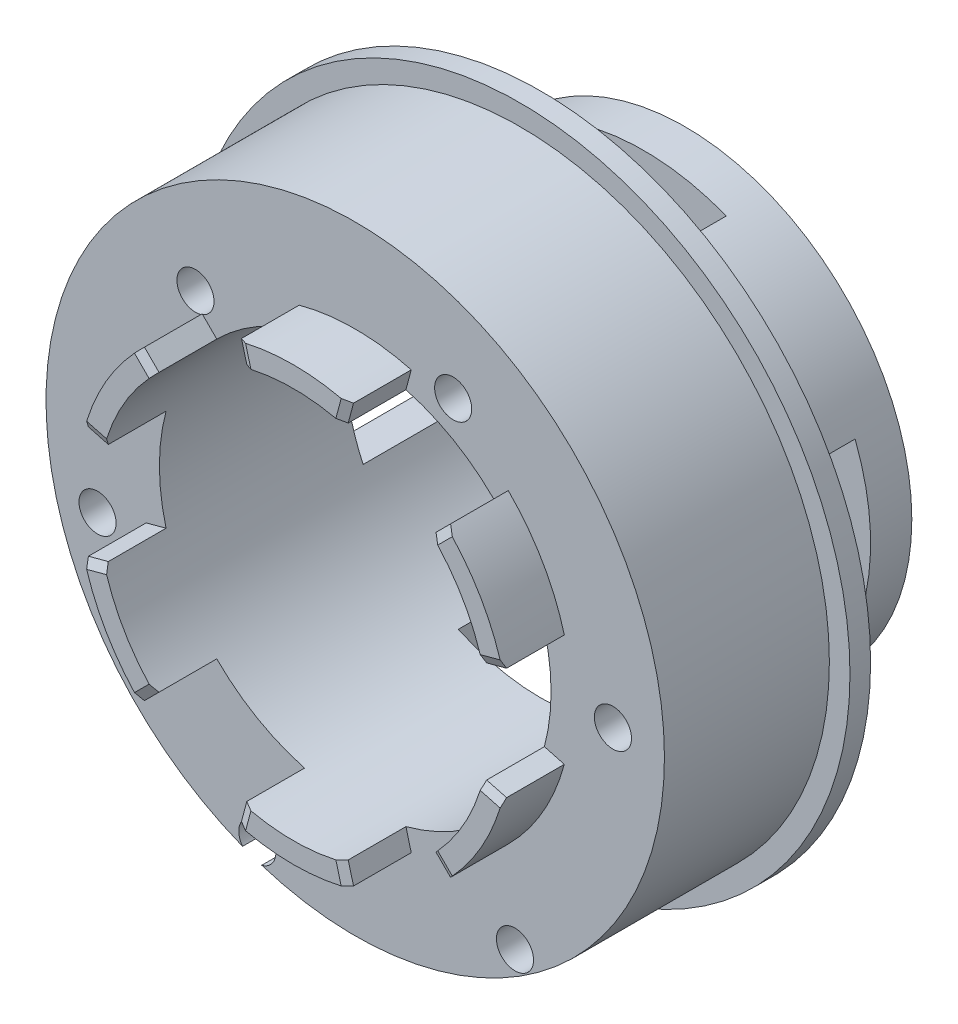
from build123d import *
from OCP.BRepFilletAPI import BRepFilletAPI_MakeChamfer

# Parameters (mm, degrees)
SKETCH_1_R               = 11
EXTRUDE_1_DEPTH          = 2
SKETCH_2_R               = 11
SKETCH_2_R_2             = 9.5
EXTRUDE_2_DEPTH          = 5
SKETCH_4_R               = 16
SKETCH_4_R_2             = 9.5
EXTRUDE_3_DEPTH          = 1
SKETCH_5_R               = 15
SKETCH_5_R_2             = 9.5
EXTRUDE_4_DEPTH          = 8
SKETCH_6_R               = 0.9
CUT_EXTRUDE_1_DEPTH      = 8
SKETCH_7_R               = 3
SKETCH_7_R_2             = 1
CUT_EXTRUDE_2_DEPTH      = 28.712812921
CUT_EXTRUDE_3_DEPTH      = 28.712812921
CUT_EXTRUDE_3_DEPTH_BACK = 28.712812921
SKETCH_8_W               = 8
SKETCH_8_H               = 5
CUT_EXTRUDE_4_DEPTH      = 28.712812921
CUT_EXTRUDE_4_DEPTH_BACK = 28.712812921
SKETCH_9_W               = 5
SKETCH_9_H               = 8
EXTRUDE_5_DEPTH          = 3
CHAMFER_1_SIZE           = 0.2
CHAMFER_1_SIZE2          = 0.410060768


with BuildPart() as part:
    # 스케치1 → 보스-돌출1 (new body)
    with BuildSketch(Plane.XY):
        Circle(SKETCH_1_R)
    extrude(amount=EXTRUDE_1_DEPTH)

    # 스케치2 → 보스-돌출2 (add)
    with BuildSketch(Plane.XY.offset(2)):
        Circle(SKETCH_2_R)
        Circle(SKETCH_2_R_2, mode=Mode.SUBTRACT)
    extrude(amount=EXTRUDE_2_DEPTH)

    # 스케치4 → 보스-돌출3 (add)
    with BuildSketch(Plane.XY.offset(7)):
        Circle(SKETCH_4_R)
        Circle(SKETCH_4_R_2, mode=Mode.SUBTRACT)
    extrude(amount=EXTRUDE_3_DEPTH)

    # 스케치5 → 보스-돌출4 (add)
    with BuildSketch(Plane.XY.offset(8)):
        Circle(SKETCH_5_R)
        Circle(SKETCH_5_R_2, mode=Mode.SUBTRACT)
    extrude(amount=EXTRUDE_4_DEPTH)

    # 스케치6 → 컷-돌출1 (cut)
    with BuildSketch(Plane.XY.offset(16)):
        with Locations((12.5, 0)):
            Circle(SKETCH_6_R)
        with Locations((7.75, -11.691342951)):
            Circle(SKETCH_6_R)
        with Locations((-4.75, -13.423393759)):
            Circle(SKETCH_6_R)
        with Locations((-12.5, -3.464101615)):
            Circle(SKETCH_6_R)
        with Locations((-7.75, 8.227241336)):
            Circle(SKETCH_6_R)
        with Locations((4.75, 9.959292144)):
            Circle(SKETCH_6_R)
    extrude(amount=-CUT_EXTRUDE_1_DEPTH, mode=Mode.SUBTRACT)

    # 스케치7 → 컷-돌출2 (cut, through all)
    with BuildSketch(Plane(origin=(0, 0, 0), x_dir=(-1, 0, 0), z_dir=(0, 0, -1))):
        Circle(SKETCH_7_R)
        with Locations((-8, 0)):
            Circle(SKETCH_7_R_2)
        with Locations((8, 0)):
            Circle(SKETCH_7_R_2)
        with Locations((0, 8)):
            Circle(SKETCH_7_R_2)
        with Locations((0, -8)):
            Circle(SKETCH_7_R_2)
    extrude(amount=-CUT_EXTRUDE_2_DEPTH, mode=Mode.SUBTRACT)

    # 스케치8 → 컷-돌출3 (cut, two sides: drawn at the far end of the back side and taken through both)
    with BuildSketch(Plane(origin=(0, 0, 0), x_dir=(1, 0, 0), z_dir=(0, 1, 0)).offset(-CUT_EXTRUDE_3_DEPTH_BACK)):
        with Locations((0, -4.5)):
            Rectangle(SKETCH_8_W, SKETCH_8_H)
    extrude(amount=CUT_EXTRUDE_3_DEPTH + CUT_EXTRUDE_3_DEPTH_BACK, mode=Mode.SUBTRACT)

    # 스케치9 → 컷-돌출4 (cut, two sides: drawn at the far end of the back side and taken through both)
    with BuildSketch(Plane(origin=(0, 0, 0), x_dir=(0, 0, -1), z_dir=(1, 0, 0)).offset(-CUT_EXTRUDE_4_DEPTH_BACK)):
        with Locations((-4.5, 0)):
            Rectangle(SKETCH_9_W, SKETCH_9_H)
    extrude(amount=CUT_EXTRUDE_4_DEPTH + CUT_EXTRUDE_4_DEPTH_BACK, mode=Mode.SUBTRACT)

    # 스케치10 → 보스-돌출5 (add)
    with BuildSketch(Plane.XY.offset(16)):
        with BuildLine():
            Line((2.458780928, 9.17629535), (2.717599974, 10.142221176))
            ThreePointArc((2.717599974, 10.142221176), (0, 10.5), (-2.717599974, 10.142221176))
            Line((-2.717599974, 10.142221176), (-2.458780928, 9.17629535))
            ThreePointArc((-2.458780928, 9.17629535), (0, 9.5), (2.458780928, 9.17629535))
        make_face()
        with BuildLine():
            Line((6.717514421, 6.717514421), (7.424621202, 7.424621202))
            ThreePointArc((7.424621202, 7.424621202), (9.09326674, 5.25), (10.142221176, 2.717599974))
            Line((10.142221176, 2.717599974), (9.17629535, 2.458780928))
            ThreePointArc((9.17629535, 2.458780928), (8.227241336, 4.75), (6.717514421, 6.717514421))
        make_face()
        with BuildLine():
            Line((9.17629535, -2.458780928), (10.142221176, -2.717599974))
            ThreePointArc((10.142221176, -2.717599974), (9.09326674, -5.25), (7.424621202, -7.424621202))
            Line((7.424621202, -7.424621202), (6.717514421, -6.717514421))
            ThreePointArc((6.717514421, -6.717514421), (8.227241336, -4.75), (9.17629535, -2.458780928))
        make_face()
        with BuildLine():
            Line((2.458780928, -9.17629535), (2.717599974, -10.142221176))
            ThreePointArc((2.717599974, -10.142221176), (0, -10.5), (-2.717599974, -10.142221176))
            Line((-2.717599974, -10.142221176), (-2.458780928, -9.17629535))
            ThreePointArc((-2.458780928, -9.17629535), (0, -9.5), (2.458780928, -9.17629535))
        make_face()
        with BuildLine():
            Line((-6.717514421, -6.717514421), (-7.424621202, -7.424621202))
            ThreePointArc((-7.424621202, -7.424621202), (-9.09326674, -5.25), (-10.142221176, -2.717599974))
            Line((-10.142221176, -2.717599974), (-9.17629535, -2.458780928))
            ThreePointArc((-9.17629535, -2.458780928), (-8.227241336, -4.75), (-6.717514421, -6.717514421))
        make_face()
        with BuildLine():
            Line((-9.17629535, 2.458780928), (-10.142221176, 2.717599974))
            ThreePointArc((-10.142221176, 2.717599974), (-9.09326674, 5.25), (-7.424621202, 7.424621202))
            Line((-7.424621202, 7.424621202), (-6.717514421, 6.717514421))
            ThreePointArc((-6.717514421, 6.717514421), (-8.227241336, 4.75), (-9.17629535, 2.458780928))
        make_face()
    extrude(amount=EXTRUDE_5_DEPTH)

    # 모따기1: one chamfer whose edges measure the first distance from different faces: ONE call of the kernel's chamfer builder (chamfer() names one face for all edges)
    chamfer_1_edges_1 = [part.edges().sort_by_distance(p)[0] for p in [
        (-9.659258263, -2.588190451, 19),
    ]]
    chamfer_1_side_1 = [part.faces().sort_by_distance(p)[0] for p in [
        (-9.659258263, -2.588190451, 17.5),
    ]]
    chamfer_1_edges_2 = [part.edges().sort_by_distance(p)[0] for p in [
        (-7.071067812, -7.071067812, 19),
    ]]
    chamfer_1_side_2 = [part.faces().sort_by_distance(p)[0] for p in [
        (-7.071067812, -7.071067812, 17.5),
    ]]
    chamfer_1_edges_3 = [part.edges().sort_by_distance(p)[0] for p in [
        (-2.588190451, -9.659258263, 19),
    ]]
    chamfer_1_side_3 = [part.faces().sort_by_distance(p)[0] for p in [
        (-2.588190451, -9.659258263, 17.5),
    ]]
    chamfer_1_edges_4 = [part.edges().sort_by_distance(p)[0] for p in [
        (2.588190451, -9.659258263, 19),
    ]]
    chamfer_1_side_4 = [part.faces().sort_by_distance(p)[0] for p in [
        (2.588190451, -9.659258263, 17.5),
    ]]
    chamfer_1_edges_5 = [part.edges().sort_by_distance(p)[0] for p in [
        (7.071067812, -7.071067812, 19),
    ]]
    chamfer_1_side_5 = [part.faces().sort_by_distance(p)[0] for p in [
        (7.071067812, -7.071067812, 17.5),
    ]]
    chamfer_1_edges_6 = [part.edges().sort_by_distance(p)[0] for p in [
        (9.659258263, -2.588190451, 19),
    ]]
    chamfer_1_side_6 = [part.faces().sort_by_distance(p)[0] for p in [
        (9.659258263, -2.588190451, 17.5),
    ]]
    chamfer_1_edges_7 = [part.edges().sort_by_distance(p)[0] for p in [
        (9.659258263, 2.588190451, 19),
    ]]
    chamfer_1_side_7 = [part.faces().sort_by_distance(p)[0] for p in [
        (9.659258263, 2.588190451, 17.5),
    ]]
    chamfer_1_edges_8 = [part.edges().sort_by_distance(p)[0] for p in [
        (7.071067812, 7.071067812, 19),
    ]]
    chamfer_1_side_8 = [part.faces().sort_by_distance(p)[0] for p in [
        (7.071067812, 7.071067812, 17.5),
    ]]
    chamfer_1_edges_9 = [part.edges().sort_by_distance(p)[0] for p in [
        (2.588190451, 9.659258263, 19),
    ]]
    chamfer_1_side_9 = [part.faces().sort_by_distance(p)[0] for p in [
        (2.588190451, 9.659258263, 17.5),
    ]]
    chamfer_1_edges_10 = [part.edges().sort_by_distance(p)[0] for p in [
        (-2.588190451, 9.659258263, 19),
    ]]
    chamfer_1_side_10 = [part.faces().sort_by_distance(p)[0] for p in [
        (-2.588190451, 9.659258263, 17.5),
    ]]
    chamfer_1_edges_11 = [part.edges().sort_by_distance(p)[0] for p in [
        (-7.071067812, 7.071067812, 19),
    ]]
    chamfer_1_side_11 = [part.faces().sort_by_distance(p)[0] for p in [
        (-7.071067812, 7.071067812, 17.5),
    ]]
    chamfer_1_edges_12 = [part.edges().sort_by_distance(p)[0] for p in [
        (-9.659258263, 2.588190451, 19),
    ]]
    chamfer_1_side_12 = [part.faces().sort_by_distance(p)[0] for p in [
        (-9.659258263, 2.588190451, 17.5),
    ]]
    chamfer_1 = BRepFilletAPI_MakeChamfer(part.part.solid().wrapped)
    for e in chamfer_1_edges_1:
        chamfer_1.Add(CHAMFER_1_SIZE, CHAMFER_1_SIZE2, e.wrapped, chamfer_1_side_1[0].wrapped)  # the first distance lies on this face
    for e in chamfer_1_edges_2:
        chamfer_1.Add(CHAMFER_1_SIZE, CHAMFER_1_SIZE2, e.wrapped, chamfer_1_side_2[0].wrapped)  # the first distance lies on this face
    for e in chamfer_1_edges_3:
        chamfer_1.Add(CHAMFER_1_SIZE, CHAMFER_1_SIZE2, e.wrapped, chamfer_1_side_3[0].wrapped)  # the first distance lies on this face
    for e in chamfer_1_edges_4:
        chamfer_1.Add(CHAMFER_1_SIZE, CHAMFER_1_SIZE2, e.wrapped, chamfer_1_side_4[0].wrapped)  # the first distance lies on this face
    for e in chamfer_1_edges_5:
        chamfer_1.Add(CHAMFER_1_SIZE, CHAMFER_1_SIZE2, e.wrapped, chamfer_1_side_5[0].wrapped)  # the first distance lies on this face
    for e in chamfer_1_edges_6:
        chamfer_1.Add(CHAMFER_1_SIZE, CHAMFER_1_SIZE2, e.wrapped, chamfer_1_side_6[0].wrapped)  # the first distance lies on this face
    for e in chamfer_1_edges_7:
        chamfer_1.Add(CHAMFER_1_SIZE, CHAMFER_1_SIZE2, e.wrapped, chamfer_1_side_7[0].wrapped)  # the first distance lies on this face
    for e in chamfer_1_edges_8:
        chamfer_1.Add(CHAMFER_1_SIZE, CHAMFER_1_SIZE2, e.wrapped, chamfer_1_side_8[0].wrapped)  # the first distance lies on this face
    for e in chamfer_1_edges_9:
        chamfer_1.Add(CHAMFER_1_SIZE, CHAMFER_1_SIZE2, e.wrapped, chamfer_1_side_9[0].wrapped)  # the first distance lies on this face
    for e in chamfer_1_edges_10:
        chamfer_1.Add(CHAMFER_1_SIZE, CHAMFER_1_SIZE2, e.wrapped, chamfer_1_side_10[0].wrapped)  # the first distance lies on this face
    for e in chamfer_1_edges_11:
        chamfer_1.Add(CHAMFER_1_SIZE, CHAMFER_1_SIZE2, e.wrapped, chamfer_1_side_11[0].wrapped)  # the first distance lies on this face
    for e in chamfer_1_edges_12:
        chamfer_1.Add(CHAMFER_1_SIZE, CHAMFER_1_SIZE2, e.wrapped, chamfer_1_side_12[0].wrapped)  # the first distance lies on this face
    add(Compound.cast(chamfer_1.Shape()), mode=Mode.REPLACE)


solid = part.part
